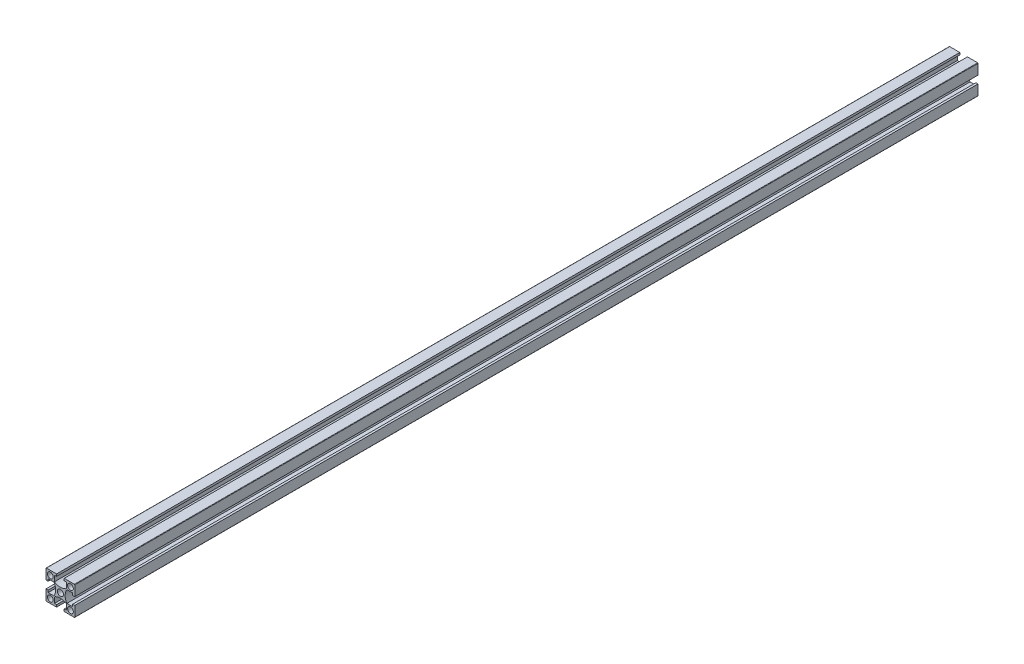
from build123d import *

# Parameters (mm, degrees)
SKETCH_1_W               = 20
SKETCH_1_H               = 20
SKETCH_1_R               = 2
SKETCH_1_R_2             = 2.15
EXTRUDE_1_DEPTH          = 628
CUT_EXTRUDE_1_REACH      = 630.159
PATTERN_CIRCULAR_1_COUNT = 4
FILLET_1_R               = 0.3
CUT_EXTRUDE_2_DEPTH      = 629.159215486
CUT_EXTRUDE_2_DEPTH_BACK = 629.159215486
SKETCH_2_R               = 2.5
SKETCH_3_R               = 2.5
CUT_EXTRUDE_3_DEPTH      = 629.397963177
SKETCH_4_R               = 2.5
CUT_EXTRUDE_4_DEPTH      = 629.397963177
SKETCH_5_R               = 2.15
SKETCH_5_R_2             = 2.12
SKETCH_5_R_3             = 2.5
CUT_EXTRUDE_5_DEPTH      = 629.397963177


with BuildPart() as part:
    # 스케치1 → 보스-돌출1 (new body)
    with BuildSketch(Plane.XY):
        Rectangle(SKETCH_1_W, SKETCH_1_H)
        with Locations((-7, -7)):
            Circle(SKETCH_1_R, mode=Mode.SUBTRACT)
        with Locations((7, -7)):
            Circle(SKETCH_1_R, mode=Mode.SUBTRACT)
        with Locations((-7, 7)):
            Circle(SKETCH_1_R, mode=Mode.SUBTRACT)
        Circle(SKETCH_1_R_2, mode=Mode.SUBTRACT)
        with Locations((7, 7)):
            Circle(SKETCH_1_R, mode=Mode.SUBTRACT)
    extrude(amount=EXTRUDE_1_DEPTH)

    # 스케치1<3> → 컷-돌출1 (cut, up to next)
    with BuildSketch(Plane.XY, mode=Mode.PRIVATE) as cut_extrude_1_sk1:
        with BuildLine():
            Line((-8.5, 2.65), (-10, 2.65))
            Line((-10, 2.65), (-10, -2.65))
            Line((-10, -2.65), (-8.5, -2.65))
            Line((-8.5, -2.65), (-8.5, -4.15))
            Line((-8.5, -4.15), (-4.503166667, -4.15))
            ThreePointArc((-4.503166667, -4.15), (-3.3, 0), (-4.503166667, 4.15))
            Line((-4.503166667, 4.15), (-8.5, 4.15))
            Line((-8.5, 4.15), (-8.5, 2.65))
        make_face()
    cut_extrude_1_tool1 = extrude(cut_extrude_1_sk1.sketch, amount=CUT_EXTRUDE_1_REACH, mode=Mode.PRIVATE) & part.part
    cut_extrude_1 = cut_extrude_1_tool1.solids().sort_by_distance((-6.606913, 0, 0))[0]
    add(cut_extrude_1, mode=Mode.SUBTRACT)

    # 원형 패턴1: 컷-돌출1 ×4 about axis
    pattern_circular_1_axis = Axis((0, 0, 628), (0, 0, -1))
    for i in range(1, PATTERN_CIRCULAR_1_COUNT):
        add(cut_extrude_1.rotate(pattern_circular_1_axis, i * 360 / PATTERN_CIRCULAR_1_COUNT), mode=Mode.SUBTRACT)

    # 필렛1
    fillet_1_edges = [part.edges().sort_by_distance(p)[0] for p in [
        (10, -10, 314),
        (-10, -10, 314),
        (-10, 10, 314),
        (10, 10, 314),
    ]]
    fillet(fillet_1_edges, radius=FILLET_1_R)

    # 스케치2 → 컷-돌출2 (cut, two sides: drawn at the far end of the back side and taken through both)
    with BuildSketch(Plane(origin=(0, 0, 0), x_dir=(0, 0, -1), z_dir=(1, 0, 0)).offset(-CUT_EXTRUDE_2_DEPTH_BACK)):
        with Locations((-15, 0)):
            Circle(SKETCH_2_R)
    extrude(amount=CUT_EXTRUDE_2_DEPTH + CUT_EXTRUDE_2_DEPTH_BACK, mode=Mode.SUBTRACT)

    # 스케치3 → 컷-돌출3 (cut, through all)
    with BuildSketch(Plane.XZ.offset(10)):
        with Locations((0, 141)):
            Circle(SKETCH_3_R)
        with Locations((0, 357)):
            Circle(SKETCH_3_R)
    extrude(amount=-CUT_EXTRUDE_3_DEPTH, mode=Mode.SUBTRACT)

    # 스케치4 → 컷-돌출4 (cut, through all)
    with BuildSketch(Plane.XZ.offset(10)):
        with Locations((0, 249)):
            Circle(SKETCH_4_R)
    extrude(amount=-CUT_EXTRUDE_4_DEPTH, mode=Mode.SUBTRACT)

    # 스케치5 → 컷-돌출5 (cut, through all)
    with BuildSketch(Plane.XZ.offset(10)):
        with Locations((0, 475)):
            Circle(SKETCH_5_R)
        with Locations((0, 423)):
            Circle(SKETCH_5_R)
        with Locations((0, 305)):
            Circle(SKETCH_5_R_2)
        with Locations((0, 238.9)):
            Circle(SKETCH_5_R)
        with Locations((0, 186.9)):
            Circle(SKETCH_5_R)
        with Locations((0, 64.15)):
            Circle(SKETCH_5_R)
        with Locations((0, 12.15)):
            Circle(SKETCH_5_R)
        with Locations((0, 617)):
            Circle(SKETCH_5_R_3)
    extrude(amount=-CUT_EXTRUDE_5_DEPTH, mode=Mode.SUBTRACT)


solid = part.part
